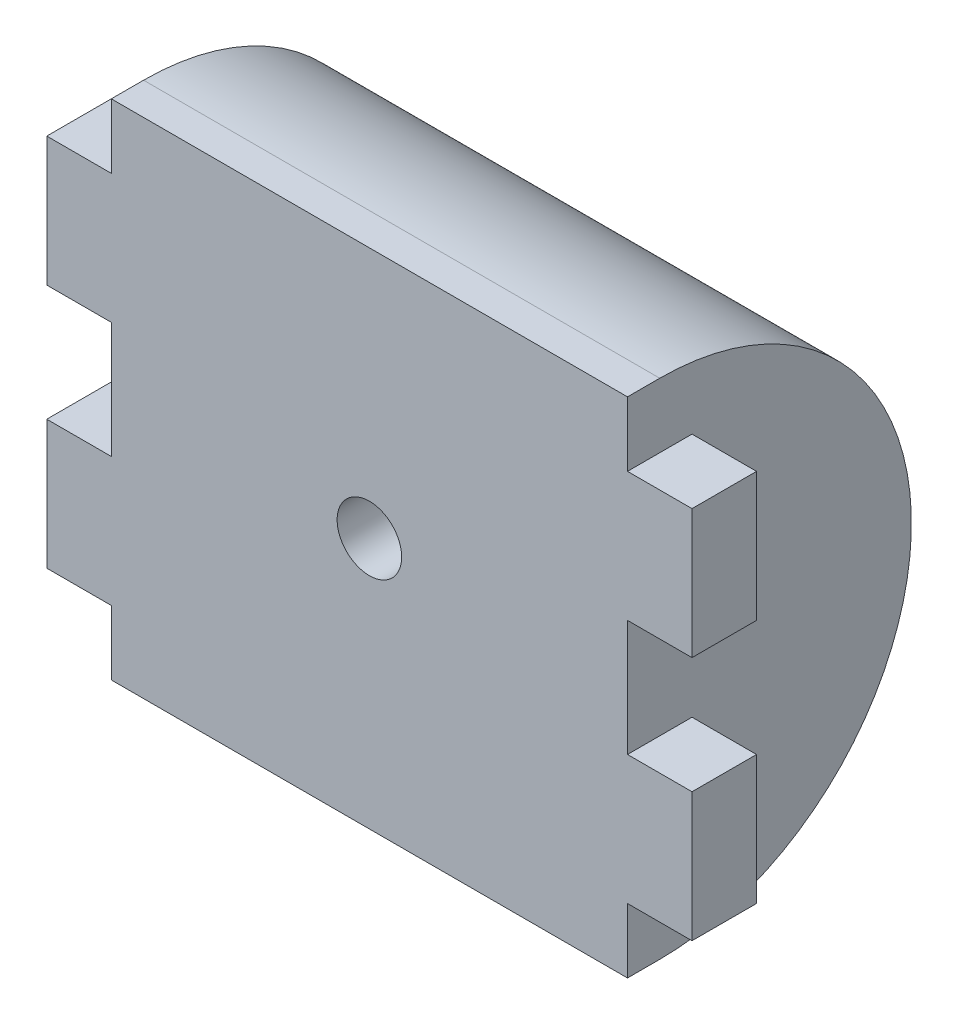
from build123d import *

# Parameters (mm, degrees)
SKETCH1_R            = 2.5
BOSS_EXTRUDE1_DEPTH  = 5
SKETCH39_W           = 40
SKETCH39_H           = 39
SKETCH39_R           = 10
BOSS_EXTRUDE13_DEPTH = 17
CUT_EXTRUDE10_DEPTH  = 57
SKETCH41_R           = 10
SKETCH41_R_2         = 2.3
BOSS_EXTRUDE14_DEPTH = 3


with BuildPart() as part:
    # Sketch1 → Boss-Extrude1 (new body)
    with BuildSketch(Plane.XY):
        Polygon((-25, 14.5), (-20, 14.5), (-20, 19.5), (20, 19.5), (20, 14.5), (25, 14.5), (25, 4.5), (20, 4.5), (20, -4.5), (25, -4.5), (25, -14.5), (20, -14.5), (20, -19.5), (-20, -19.5), (-20, -14.5), (-25, -14.5), (-25, -4.5), (-20, -4.5), (-20, 4.5), (-25, 4.5), align=None)
        Circle(SKETCH1_R, mode=Mode.SUBTRACT)
    extrude(amount=BOSS_EXTRUDE1_DEPTH)

    # Sketch39 → Boss-Extrude13 (add)
    with BuildSketch(Plane(origin=(0, 0, 0), x_dir=(-1, 0, 0), z_dir=(0, 0, -1))):
        Rectangle(SKETCH39_W, SKETCH39_H)
        Circle(SKETCH39_R, mode=Mode.SUBTRACT)
    extrude(amount=BOSS_EXTRUDE13_DEPTH)

    # Sketch40 → Cut-Extrude10 (cut)
    with BuildSketch(Plane(origin=(20, 0, 0), x_dir=(0, 0, -1), z_dir=(1, 0, 0))):
        with BuildLine():
            Line((17, 19.5), (-2.5, 19.5))
            ThreePointArc((-2.5, 19.5), (11.288582228, 13.788582238), (17, 1.4e-08))
            Line((17, 1.4e-08), (17, 19.5))
        make_face()
        with BuildLine():
            ThreePointArc((17, 1.4e-08), (11.288582238, -13.788582228), (-2.5, -19.5))
            Line((-2.5, -19.5), (17, -19.5))
            Line((17, -19.5), (17, 1.4e-08))
        make_face()
    extrude(amount=-CUT_EXTRUDE10_DEPTH, mode=Mode.SUBTRACT)

    # Sketch41 → Boss-Extrude14 (add)
    with BuildSketch(Plane(origin=(0, 0, 0), x_dir=(-1, 0, 0), z_dir=(0, 0, -1))):
        Circle(SKETCH41_R)
        Circle(SKETCH41_R_2, mode=Mode.SUBTRACT)
    extrude(amount=BOSS_EXTRUDE14_DEPTH)


solid = part.part
